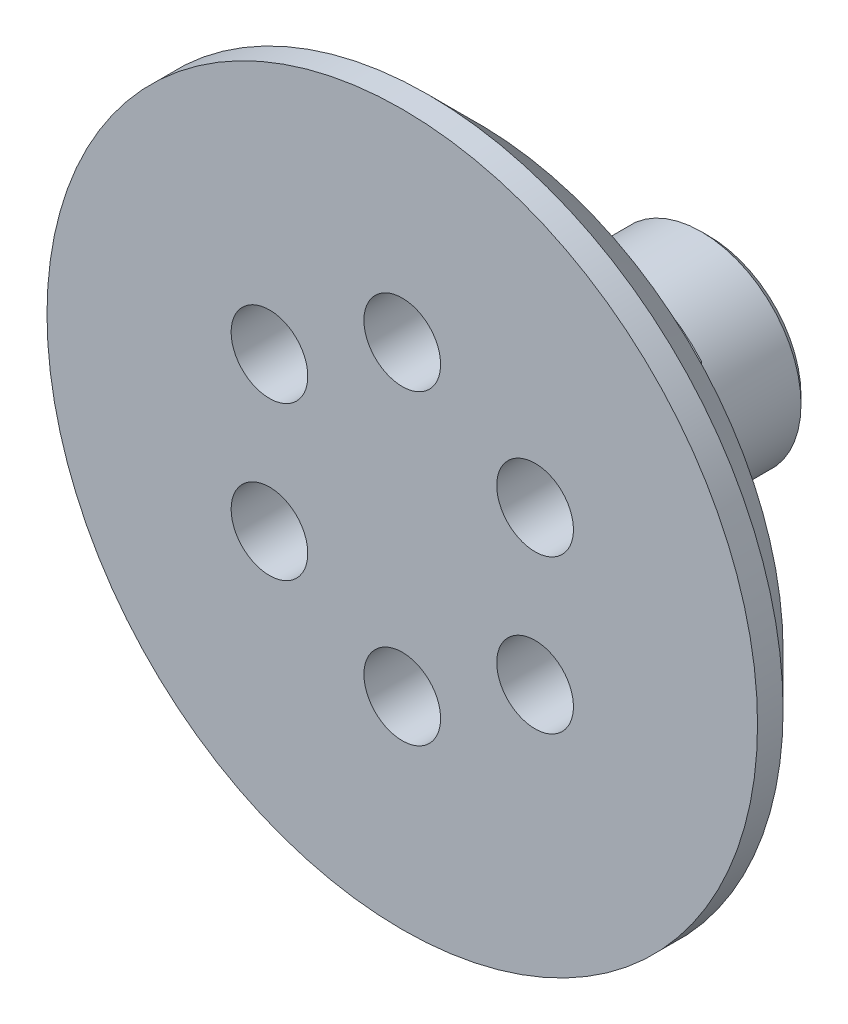
from build123d import *

# Parameters (mm, degrees)
SKETCH_1_R               = 3.9
SKETCH_1_R_2             = 2.65
EXTRUDE_1_DEPTH          = 11
EXTRUDE_START            = -3
SKETCH_2_R               = 2.65
EXTRUDE_2_DEPTH          = 3
EXTRUDE_START_2          = 6.2
EXTRUDE_3_DEPTH          = 6.2
CHAMFER_1_SIZE           = 0.3
CHAMFER_2_SIZE           = 0.3
EXTRUDE_4_DEPTH          = 1
EXTRUDE_4_DEPTH_BACK     = 2
SKETCH_4_R               = 13.9
SKETCH_5_R               = 4.9
SKETCH_5_R_2             = 3.7
EXTRUDE_5_DEPTH          = 5
CHAMFER_4_SIZE           = 2
CUT_EXTRUDE_1_DEPTH      = 22.619898242
CUT_EXTRUDE_1_DEPTH_BACK = 22.619898242
SKETCH_6_R               = 1.5
CHAMFER_5_SIZE           = 1
CHAMFER_6_SIZE           = 1


with BuildPart() as part:
    # 草图1 → 凸台-拉伸1 (new body)
    with BuildSketch(Plane.XY):
        Circle(SKETCH_1_R)
        Circle(SKETCH_1_R_2, mode=Mode.SUBTRACT)
    extrude(amount=EXTRUDE_1_DEPTH)

    # 草图2 → 凸台-拉伸2 (add)
    with BuildSketch(Plane.XY.offset(11).offset(EXTRUDE_START)):
        Circle(SKETCH_2_R)
    extrude(amount=EXTRUDE_2_DEPTH)

    # 草图3 → 凸台-拉伸3 (add)
    with BuildSketch(Plane(origin=(0, 0, 8), x_dir=(-1, 0, 0), z_dir=(0, 0, -1)).offset(EXTRUDE_START_2)):
        with BuildLine():
            Line((-1.65, -2.073644135), (-1.65, 2.073644135))
            ThreePointArc((-1.65, 2.073644135), (-2.65, 0), (-1.65, -2.073644135))
        make_face()
        with BuildLine():
            ThreePointArc((2.65, 0), (2.386943652, 1.151086443), (1.65, 2.073644135))
            Line((1.65, 2.073644135), (1.65, -2.073644135))
            ThreePointArc((1.65, -2.073644135), (2.386943652, -1.151086443), (2.65, 0))
        make_face()
    extrude(amount=-EXTRUDE_3_DEPTH)

    # 倒角1
    chamfer_1_edges = [part.edges().sort_by_distance(p)[0] for p in [
        (-2.65, 0, 0),
    ]]
    chamfer(chamfer_1_edges, length=CHAMFER_1_SIZE)

    # 倒角2
    chamfer_2_edges = [part.edges().sort_by_distance(p)[0] for p in [
        (-3.9, 0, 0),
    ]]
    chamfer(chamfer_2_edges, length=CHAMFER_2_SIZE)

    # 草图4 → 凸台-拉伸4 (add, two sides: drawn at the far end of the back side and taken through both)
    with BuildSketch(Plane.XY.offset(11).offset(-EXTRUDE_4_DEPTH_BACK)):
        Circle(SKETCH_4_R)
    extrude(amount=EXTRUDE_4_DEPTH + EXTRUDE_4_DEPTH_BACK)

    # 草图5 → 凸台-拉伸5 (add)
    with BuildSketch(Plane(origin=(0, 0, 9), x_dir=(-1, 0, 0), z_dir=(0, 0, -1))):
        with Locations(Location((0, 0, 0), (0, 0, 180))):
            Circle(SKETCH_5_R)
        Circle(SKETCH_5_R_2, mode=Mode.SUBTRACT)
    extrude(amount=EXTRUDE_5_DEPTH)

    # 倒角4
    chamfer_4_edges = [part.edges().sort_by_distance(p)[0] for p in [
        (-13.9, 0, 9),
    ]]
    chamfer(chamfer_4_edges, length=CHAMFER_4_SIZE)

    # 草图6 → 切除-拉伸1 (cut, two sides: drawn at the far end of the back side and taken through both)
    with BuildSketch(Plane(origin=(0, 0, 9), x_dir=(-1, 0, 0), z_dir=(0, 0, -1)).offset(-CUT_EXTRUDE_1_DEPTH_BACK)):
        with Locations((0, 6)):
            Circle(SKETCH_6_R)
        with Locations((5.196152423, 3)):
            Circle(SKETCH_6_R)
        with Locations((5.196152423, -3)):
            Circle(SKETCH_6_R)
        with Locations((0, -6)):
            Circle(SKETCH_6_R)
        with Locations((-5.196152423, -3)):
            Circle(SKETCH_6_R)
        with Locations((-5.196152423, 3)):
            Circle(SKETCH_6_R)
    extrude(amount=CUT_EXTRUDE_1_DEPTH + CUT_EXTRUDE_1_DEPTH_BACK, mode=Mode.SUBTRACT)

    # 倒角5
    chamfer_5_edges = [part.edges().sort_by_distance(p)[0] for p in [
        (-1.65, 0, 1.8),
    ]]
    chamfer(chamfer_5_edges, length=CHAMFER_5_SIZE - 0.0001)  # a hair under: the kernel refuses the full size

    # 倒角6
    chamfer_6_edges = [part.edges().sort_by_distance(p)[0] for p in [
        (1.65, 0, 1.8),
    ]]
    chamfer(chamfer_6_edges, length=CHAMFER_6_SIZE - 0.0001)  # a hair under: the kernel refuses the full size


solid = part.part
